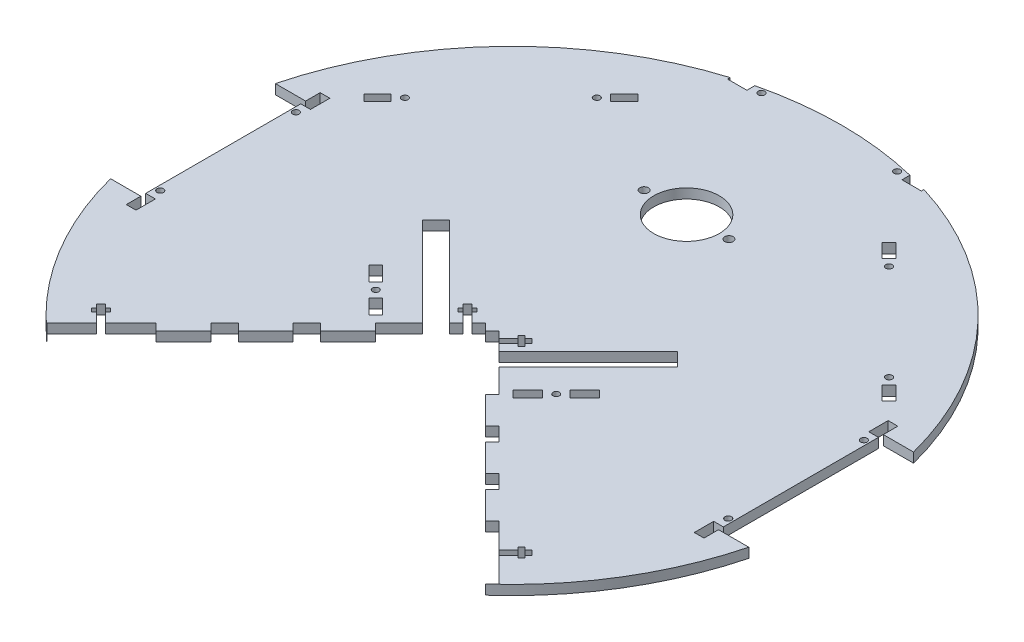
from build123d import *

# Parameters (mm, degrees)
SKETCH1_R                   = 215.9
BASE_PLATE_DEPTH            = 6.35
V_FUNNEL_CUT_DEPTH          = 306.394732273
SKETCH4_W                   = 26.67
SKETCH4_H                   = 107.95
WHEEL_HOLE_SLOT_DEPTH       = 306.394732273
SKETCH6_R                   = 2.0955
ARM_POST_CONNECTOR_DEPTH    = 301.58716186
SKETCH8_R                   = 2.1336
SKETCH8_W                   = 6.35
SKETCH8_H                   = 12.7
MOTOR_MOUNT_CONNECTOR_DEPTH = 301.58716186
SKETCH9_R                   = 2.1336
SKETCH9_W                   = 12.7
SKETCH9_H                   = 6.35
BACK_MOUNT_CONNECTOR_DEPTH  = 301.58716186
SKETCH10_R                  = 2.1336
SIDE_ASS_CONNECTOR_DEPTH    = 301.58716186
SKETCH11_R                  = 21.463
SKETCH11_R_2                = 2.778125
CASTER_WHEEL_HOLE_DEPTH     = 301.58716186
SKETCH12_W                  = 50.623338062
SKETCH12_H                  = 6.35
SKETCH12_W_2                = 12.7
SKETCH12_W_3                = 50.976661938
V_FUNNEL_TABS_DEPTH         = 6.35
PEG_CLEARANCE_DEPTH         = 301.58716186
V_FUNNEL_T_SLOT_1_DEPTH     = 301.58716186
V_FUNNEL_T_SLOT_2_DEPTH     = 301.58716186


with BuildPart() as part:
    # Sketch1 → Base Plate (new body)
    with BuildSketch(Plane(origin=(0, 0, 0), x_dir=(1, 0, 0), z_dir=(0, 1, 0))):
        Circle(SKETCH1_R)
    extrude(amount=BASE_PLATE_DEPTH)

    # Sketch2 → V Funnel Cut (cut, through all)
    with BuildSketch(Plane(origin=(0, 6.35, 0), x_dir=(1, 0, 0), z_dir=(0, 1, 0))):
        with BuildLine():
            Line((0, -17.460836827), (-143.684097937, -161.144934764))
            ThreePointArc((-143.684097937, -161.144934764), (0, -215.9), (143.684097937, -161.144934764))
            Line((143.684097937, -161.144934764), (0, -17.460836827))
        make_face()
    extrude(amount=-V_FUNNEL_CUT_DEPTH, mode=Mode.SUBTRACT)

    # Sketch4 → Wheel Hole Slot (cut, through all)
    with BuildSketch(Plane(origin=(0, 6.35, 0), x_dir=(1, 0, 0), z_dir=(0, 1, 0))):
        with Locations((-202.565, 0)):
            Rectangle(SKETCH4_W, SKETCH4_H)
    wheel_hole_slot = extrude(amount=-WHEEL_HOLE_SLOT_DEPTH, mode=Mode.SUBTRACT)

    # Wheel Slot Mirror: Wheel Hole Slot across plane
    add(wheel_hole_slot.mirror(Plane(origin=(0, 0, 0), x_dir=(0, 0, 1), z_dir=(1, 0, 0))), mode=Mode.SUBTRACT)

    # Sketch6 → Arm Post Connector (cut, through all)
    with BuildSketch(Plane(origin=(0, 6.35, 0), x_dir=(1, 0, 0), z_dir=(0, 1, 0))):
        with Locations((-59.123400668, -30.179485128)):
            Circle(SKETCH6_R)
        Polygon((-61.368464698, -23.444293037), (-71.1004567, -13.712301035), (-75.59058476, -18.202429096), (-65.858592758, -27.934421097), align=None)
        Polygon((-52.388208577, -32.424549158), (-42.656216575, -42.15654116), (-47.146344636, -46.64666922), (-56.878336637, -36.914677218), align=None)
    arm_post_connector = extrude(amount=-ARM_POST_CONNECTOR_DEPTH, mode=Mode.SUBTRACT)

    # Arm Post Connector Mirror: Arm Post Connector across plane
    add(arm_post_connector.mirror(Plane(origin=(0, 0, 0), x_dir=(0, 0, 1), z_dir=(1, 0, 0))), mode=Mode.SUBTRACT)

    # Sketch8 → Motor Mount Connector (cut, through all)
    with BuildSketch(Plane.XZ):
        with Locations((-186.055, -44.45)):
            Circle(SKETCH8_R)
        with Locations((-186.055, 44.45)):
            Circle(SKETCH8_R)
        with Locations((-186.055, -57.15)):
            Rectangle(SKETCH8_W, SKETCH8_H)
        with Locations((-186.055, 57.15)):
            Rectangle(SKETCH8_W, SKETCH8_H)
    motor_mount_connector = extrude(amount=-MOTOR_MOUNT_CONNECTOR_DEPTH, mode=Mode.SUBTRACT)

    # Motor Mount Connector Mirror: Motor Mount Connector across plane
    add(motor_mount_connector.mirror(Plane(origin=(0, 0, 0), x_dir=(0, 0, 1), z_dir=(1, 0, 0))), mode=Mode.SUBTRACT)

    # Sketch9 → Back Mount Connector (cut, through all)
    with BuildSketch(Plane.XZ):
        with Locations((-44.45, -207.81727558)):
            Circle(SKETCH9_R)
        with Locations((44.45, -207.81727558)):
            Circle(SKETCH9_R)
        with Locations((-57.15, -207.81727558)):
            Rectangle(SKETCH9_W, SKETCH9_H)
        with Locations((57.15, -207.81727558)):
            Rectangle(SKETCH9_W, SKETCH9_H)
    extrude(amount=-BACK_MOUNT_CONNECTOR_DEPTH, mode=Mode.SUBTRACT)

    # Sketch10 → Side Ass Connector (cut, through all)
    with BuildSketch(Plane.XZ):
        with Locations((-158.570308601, -88.386734728)):
            Circle(SKETCH10_R)
        with Locations((-95.708515754, -151.248527576)):
            Circle(SKETCH10_R)
        Polygon((-174.285756813, -77.161414577), (-165.305500692, -86.141670698), (-160.815372631, -81.651542638), (-169.795628752, -72.671286516), align=None)
        Polygon((-93.463451723, -157.983719667), (-84.483195602, -166.963975788), (-79.993067542, -162.473847727), (-88.973323663, -153.493591606), align=None)
    side_ass_connector = extrude(amount=-SIDE_ASS_CONNECTOR_DEPTH, mode=Mode.SUBTRACT)

    # Side Ass Connector Mirror: Side Ass Connector across plane
    add(side_ass_connector.mirror(Plane(origin=(0, 0, 0), x_dir=(0, 0, 1), z_dir=(1, 0, 0))), mode=Mode.SUBTRACT)

    # Sketch11 → Caster Wheel Hole (cut, through all)
    with BuildSketch(Plane(origin=(0, 6.35, 0), x_dir=(1, 0, 0), z_dir=(0, 1, 0))):
        with Locations((0, 114.3)):
            Circle(SKETCH11_R)
        with Locations((27.78125, 114.3)):
            Circle(SKETCH11_R_2)
        with Locations((-27.78125, 114.3)):
            Circle(SKETCH11_R_2)
    extrude(amount=-CASTER_WHEEL_HOLE_DEPTH, mode=Mode.SUBTRACT)

    # Sketch12 → V Funnel Tabs (cut)
    with BuildSketch(Plane(origin=(8.730418413, 0, 8.730418413), x_dir=(0.7071067811865489, 0, -0.7071067811865462), z_dir=(0.7071067811865462, 0, 0.7071067811865489))):
        with Locations((-190.235007094, 3.175)):
            Rectangle(SKETCH12_W, SKETCH12_H)
        with Locations((-133.173338063, 3.175)):
            Rectangle(SKETCH12_W_2, SKETCH12_H)
        with Locations((-95.073338063, 3.175)):
            Rectangle(SKETCH12_W_2, SKETCH12_H)
        with Locations((-37.835007094, 3.175)):
            Rectangle(SKETCH12_W_3, SKETCH12_H)
    v_funnel_tabs = extrude(amount=-V_FUNNEL_TABS_DEPTH, mode=Mode.SUBTRACT)

    # V Funnel Tab Mirror: V Funnel Tabs across plane
    add(v_funnel_tabs.mirror(Plane(origin=(0, 0, 0), x_dir=(0, 0, 1), z_dir=(1, 0, 0))), mode=Mode.SUBTRACT)

    # Sketch13 → Peg Clearance (cut, through all)
    with BuildSketch(Plane(origin=(0, 6.35, 0), x_dir=(1, 0, 0), z_dir=(0, 1, 0))):
        Polygon((-11.689323621, -29.150160448), (-20.669579742, -38.130416569), (-83.53137259, 24.731376279), (-74.551116469, 33.7116324), align=None)
    peg_clearance = extrude(amount=-PEG_CLEARANCE_DEPTH, mode=Mode.SUBTRACT)

    # Peg Clearance Mirror: Peg Clearance across plane
    add(peg_clearance.mirror(Plane(origin=(0, 0, 0), x_dir=(0, 0, 1), z_dir=(1, 0, 0))), mode=Mode.SUBTRACT)

    # Sketch14 → V Funnel T Slot 1 (cut, through all)
    with BuildSketch(Plane(origin=(0, 6.35, 0), x_dir=(1, 0, 0), z_dir=(0, 1, 0))):
        Polygon((-11.843472899, -20.324053605), (-8.826106843, -17.306687548), (-15.022483566, -11.110310825), (-13.388076952, -9.475904211), (-15.633140983, -7.23084018), (-17.267547597, -8.865246794), (-19.602414188, -6.530380203), (-22.619780245, -9.54774626), (-20.284913653, -11.882612851), (-21.919320267, -13.517019465), (-19.674256237, -15.762083495), (-18.039849623, -14.127676881), align=None)
    v_funnel_t_slot_1 = extrude(amount=-V_FUNNEL_T_SLOT_1_DEPTH, mode=Mode.SUBTRACT)

    # Sketch15 → V Funnel T Slot 2 (cut, through all)
    with BuildSketch(Plane(origin=(0, 6.35, 0), x_dir=(1, 0, 0), z_dir=(0, 1, 0))):
        Polygon((-131.909775065, -140.39035577), (-128.892409008, -137.372989714), (-135.088785732, -131.17661299), (-133.454379117, -129.542206376), (-135.699443148, -127.297142346), (-137.333849762, -128.93154896), (-139.668716353, -126.596682368), (-142.68608241, -129.614048425), (-140.351215818, -131.948915016), (-141.985622433, -133.58332163), (-139.740558402, -135.828385661), (-138.106151788, -134.193979047), align=None)
    v_funnel_t_slot_2 = extrude(amount=-V_FUNNEL_T_SLOT_2_DEPTH, mode=Mode.SUBTRACT)

    # Mirror1: V Funnel T Slot 1, V Funnel T Slot 2 across plane
    add(v_funnel_t_slot_1.mirror(Plane(origin=(0, 0, 0), x_dir=(0, 0, 1), z_dir=(1, 0, 0))), mode=Mode.SUBTRACT)
    add(v_funnel_t_slot_2.mirror(Plane(origin=(0, 0, 0), x_dir=(0, 0, 1), z_dir=(1, 0, 0))), mode=Mode.SUBTRACT)


solid = part.part
